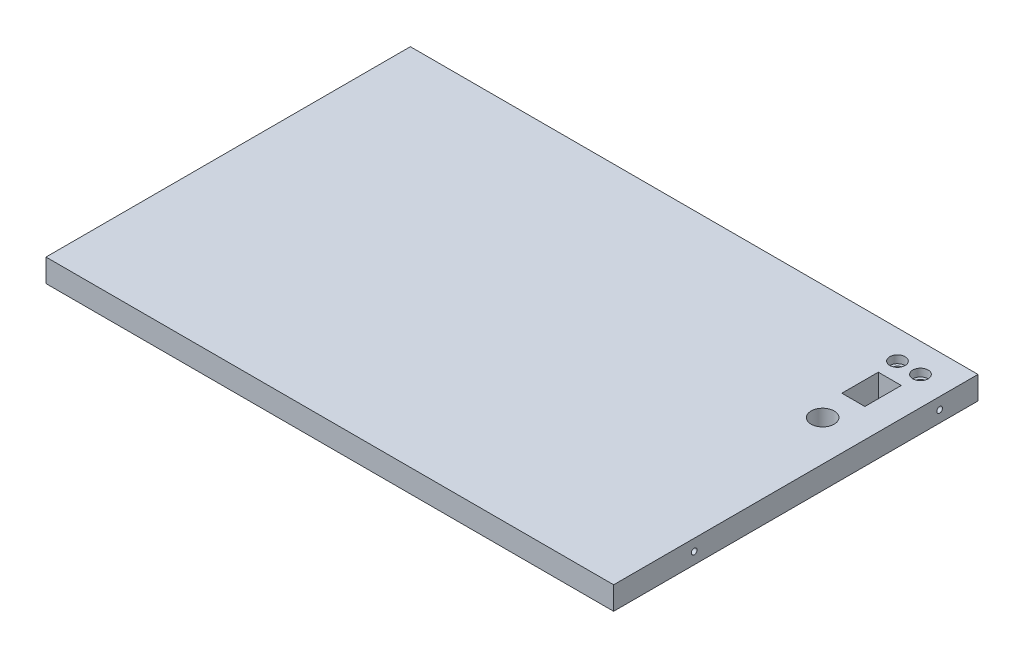
from build123d import *
from OCP.BRepAlgoAPI import BRepAlgoAPI_Cut
from OCP.TopTools import TopTools_ListOfShape

# Parameters (mm, degrees)
SKETCH1_W           = 296
SKETCH1_H           = 190
SKETCH1_R           = 6
SKETCH1_R_2         = 2.5
SKETCH1_W_2         = 12
SKETCH1_H_2         = 19
BOSS_EXTRUDE1_DEPTH = 12
CUT_EXTRUDE2_START  = 104.787049
SKETCH3_R           = 1.5
CUT_EXTRUDE2_DEPTH  = 20
CUT_EXTRUDE3_START  = -171.212951
SKETCH3_2_R         = 1.5
CUT_EXTRUDE3_DEPTH  = 20
CUT_EXTRUDE4_START  = 12
SKETCH4_R           = 4
CUT_EXTRUDE4_DEPTH  = 4


with BuildPart() as part:
    # Sketch1 → Boss-Extrude1 (new body)
    with BuildSketch(Plane(origin=(0, 0, 0), x_dir=(1, 0, 0), z_dir=(0, 1, 0))):
        with Locations((-43.212950637, 23.312387878)):
            Rectangle(SKETCH1_W, SKETCH1_H)
        with Locations(Location((83.787049363, 58.312387878, 0), (0, 0, 270))):
            Circle(SKETCH1_R, mode=Mode.SUBTRACT)
        with Locations(Location((89.787049363, 103.312387878, 0), (0, 0, 270))):
            Circle(SKETCH1_R_2, mode=Mode.SUBTRACT)
        with Locations(Location((77.787049363, 103.312387878, 0), (0, 0, 270))):
            Circle(SKETCH1_R_2, mode=Mode.SUBTRACT)
        with Locations((83.787049363, 83.812387878)):
            Rectangle(SKETCH1_W_2, SKETCH1_H_2, mode=Mode.SUBTRACT)
    extrude(amount=BOSS_EXTRUDE1_DEPTH)


with BuildPart() as cut_extrude2_tool:
    # Sketch3 → Cut-Extrude2 (new body)
    with BuildSketch(Plane(origin=(0, 0, 0), x_dir=(0, 0, -1), z_dir=(1, 0, 0)).offset(CUT_EXTRUDE2_START)):
        with Locations(Location((98.312387878, 6, 0), (0, 0, 180))):
            Circle(SKETCH3_R)
        with Locations(Location((-29.687612122, 6, 0), (0, 0, 180))):
            Circle(SKETCH3_R)
    extrude(amount=-CUT_EXTRUDE2_DEPTH)


with BuildPart() as part_1:
    add(part.part)

    # Cut-Extrude2: cut by cut_extrude2_tool, with a tolerance
    cut_extrude2_stock = TopTools_ListOfShape()
    cut_extrude2_stock.Append(part_1.part.wrapped)
    cut_extrude2_tools = TopTools_ListOfShape()
    cut_extrude2_tools.Append(cut_extrude2_tool.part.wrapped)
    cut_extrude2_cut = BRepAlgoAPI_Cut()
    cut_extrude2_cut.SetArguments(cut_extrude2_stock)
    cut_extrude2_cut.SetTools(cut_extrude2_tools)
    cut_extrude2_cut.SetFuzzyValue(0.00001)
    cut_extrude2_cut.Build()
    add(Compound.cast(cut_extrude2_cut.Shape()).solids(), mode=Mode.REPLACE)

    # Sketch3<2> → Cut-Extrude3 (cut)
    with BuildSketch(Plane(origin=(0, 0, 0), x_dir=(0, 0, -1), z_dir=(1, 0, 0)).offset(CUT_EXTRUDE3_START)):
        with Locations(Location((98.312387878, 6, 0), (0, 0, 180))):
            Circle(SKETCH3_2_R)
        with Locations(Location((-29.687612122, 6, 0), (0, 0, 180))):
            Circle(SKETCH3_2_R)
    extrude(amount=-CUT_EXTRUDE3_DEPTH, mode=Mode.SUBTRACT)

    # Sketch4 → Cut-Extrude4 (cut)
    with BuildSketch(Plane(origin=(0, 0, 0), x_dir=(1, 0, 0), z_dir=(0, 1, 0)).offset(CUT_EXTRUDE4_START)):
        with Locations(Location((89.787049363, 103.312387878, 0), (0, 0, 270))):
            Circle(SKETCH4_R)
        with Locations(Location((77.787049363, 103.312387878, 0), (0, 0, 270))):
            Circle(SKETCH4_R)
    extrude(amount=-CUT_EXTRUDE4_DEPTH, mode=Mode.SUBTRACT)


solid = part_1.part
